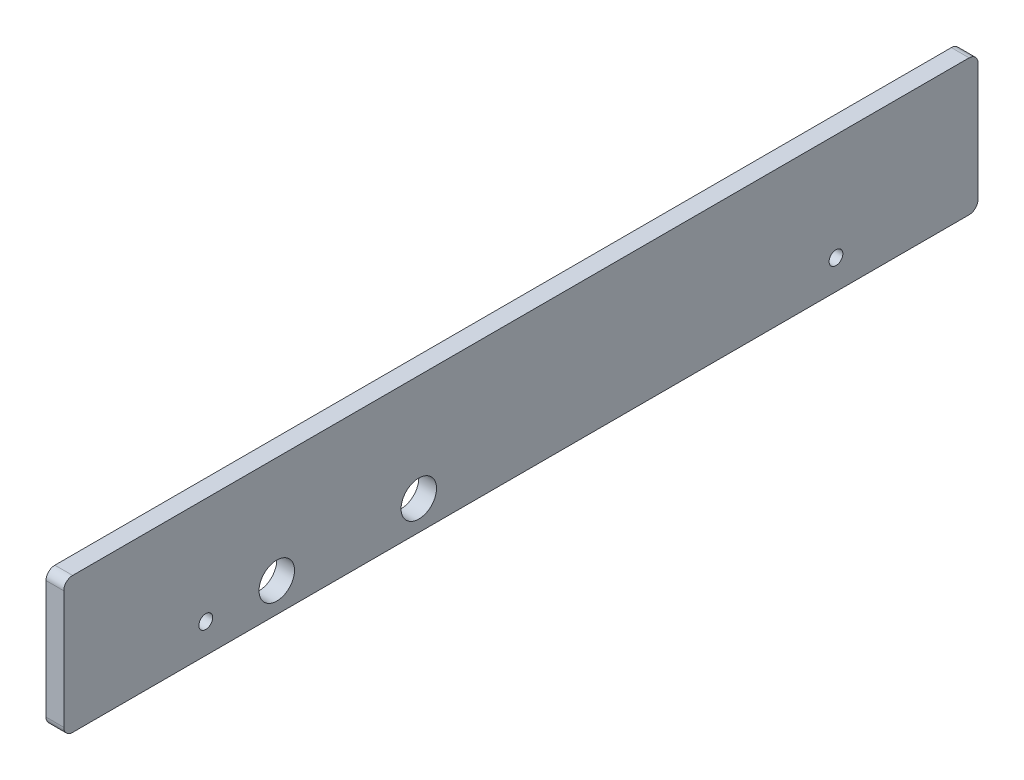
from build123d import *

# Parameters (mm, degrees)
SKETCH1_W           = 327.025
SKETCH1_H           = 48.63592
SKETCH1_R           = 2.45745
SKETCH1_R_2         = 6.35
BOSS_EXTRUDE1_DEPTH = 6.35
FILLET1_R           = 3.175


with BuildPart() as part:
    # Sketch1 → Boss-Extrude1 (new body)
    with BuildSketch(Plane(origin=(0, 0, 0), x_dir=(0, 0, -1), z_dir=(1, 0, 0))):
        with Locations((163.5125, 24.31796)):
            Rectangle(SKETCH1_W, SKETCH1_H)
        with Locations((50.8, 10.53592)):
            Circle(SKETCH1_R, mode=Mode.SUBTRACT)
        with Locations((276.225, 10.53592)):
            Circle(SKETCH1_R, mode=Mode.SUBTRACT)
        with Locations((76.2, 10.53592)):
            Circle(SKETCH1_R_2, mode=Mode.SUBTRACT)
        with Locations((127, 10.53592)):
            Circle(SKETCH1_R_2, mode=Mode.SUBTRACT)
    extrude(amount=BOSS_EXTRUDE1_DEPTH)

    # Fillet1
    fillet1_edges = [part.edges().sort_by_distance(p)[0] for p in [
        (3.175, 48.63592, -327.025),
        (3.175, 0, -327.025),
        (3.175, 0, 0),
        (3.175, 48.63592, 0),
    ]]
    fillet(fillet1_edges, radius=FILLET1_R)


solid = part.part
